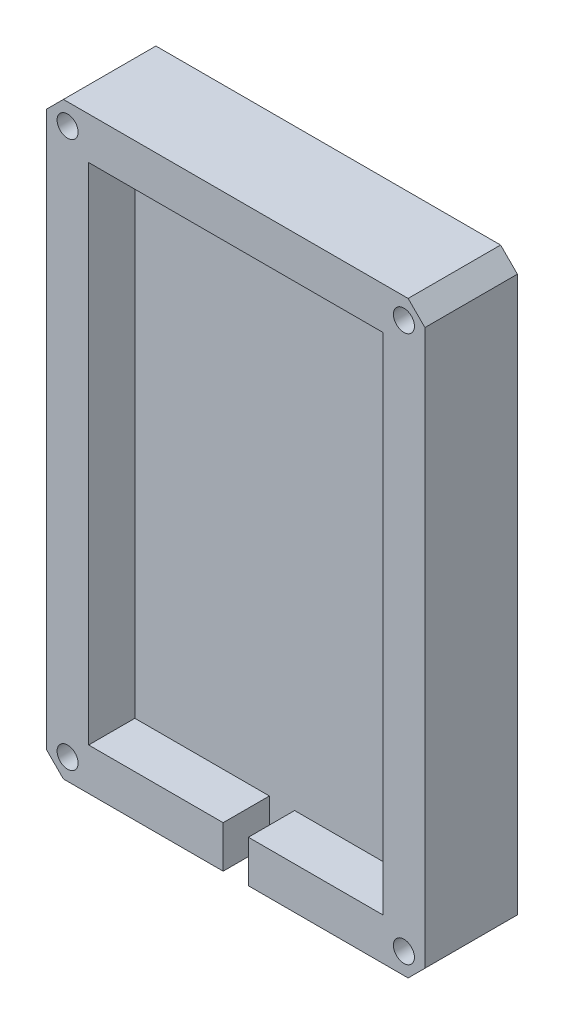
from build123d import *

# Parameters (mm, degrees)
BOSS_EXTRUDE1_DEPTH               = 5.5
SKETCH1_3_W                       = 45
SKETCH1_3_H                       = 70
BOSS_EXTRUDE2_DEPTH               = 5.5
TAP_DRILL_FOR_M3_TAP1_D           = 2.5
TAP_DRILL_FOR_M3_TAP1_CSINK_D     = 2.55
TAP_DRILL_FOR_M3_TAP1_CSINK_ANGLE = 90
CHAMFER1_SIZE                     = 2


with BuildPart() as part:
    # Sketch1 → Boss-Extrude1 (new body)
    with BuildSketch(Plane.XY):
        Polygon((1.5, -35), (22.5, -35), (22.5, 35), (-22.5, 35), (-22.5, -35), (-1.5, -35), (-1.5, -30), (-17.5, -30), (-17.5, 30), (17.5, 30), (17.5, -30), (1.5, -30), align=None)
    extrude(amount=BOSS_EXTRUDE1_DEPTH)

    # Sketch1<3> → Boss-Extrude2 (add)
    with BuildSketch(Plane.XY):
        Rectangle(SKETCH1_3_W, SKETCH1_3_H)
    extrude(amount=-BOSS_EXTRUDE2_DEPTH)

    # Tap Drill for M3 Tap1 (through all)
    with Locations(Plane(origin=(0, 0, -5.5), x_dir=(-1, 0, 0), z_dir=(0, 0, -1))):
        with Locations((20, 32.5), (-20, 32.5), (-20, -32.5), (20, -32.5)):
            CounterSinkHole(TAP_DRILL_FOR_M3_TAP1_D / 2, TAP_DRILL_FOR_M3_TAP1_CSINK_D / 2, counter_sink_angle=TAP_DRILL_FOR_M3_TAP1_CSINK_ANGLE)

    # Chamfer1
    chamfer1_edges = [part.edges().sort_by_distance(p)[0] for p in [
        (22.5, -35, 0),
        (22.5, 35, 0),
        (-22.5, 35, 0),
        (-22.5, -35, 0),
    ]]
    chamfer(chamfer1_edges, length=CHAMFER1_SIZE)


solid = part.part
